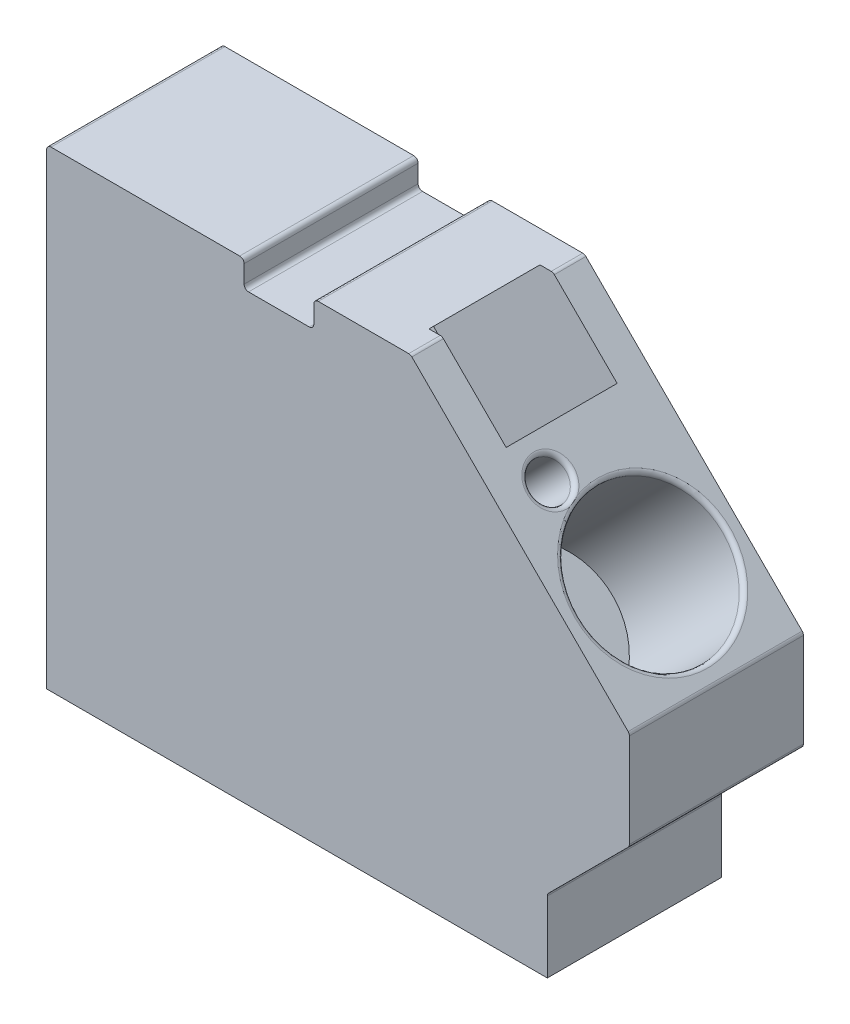
from build123d import *

# Parameters (mm, degrees)
EXTRUDE1_DEPTH = 9.9568
SKETCH2_R      = 4.191000000000001
SKETCH2_R_2    = 1.079499999999997
EXTRUDE2_DEPTH = 9.144
FILLET1_R      = 0.254


with BuildPart() as part:
    # Sketch1 → Extrude1 (new body)
    with BuildSketch(Plane.XY):
        with BuildLine():
            Line((0, 0), (0, 26.720799999999993))
            ThreePointArc((0, 26.720799999999993), (0.07439487757861757, 26.900405122421375), (0.2540000000000018, 26.974799999999995))
            Line((0.2540000000000018, 26.974799999999995), (11.048999999999998, 26.9748))
            ThreePointArc((11.048999999999998, 26.9748), (11.228605122421383, 26.900405122421382), (11.303, 26.720799999999997))
            Line((11.303, 26.720799999999997), (11.303, 25.704799999999995))
            ThreePointArc((11.303, 25.704799999999995), (11.377394877578618, 25.52519487757861), (11.557000000000002, 25.450799999999994))
            Line((11.557000000000002, 25.450799999999994), (15.036799999999998, 25.450799999999994))
            ThreePointArc((15.036799999999998, 25.450799999999994), (15.216405122421383, 25.52519487757861), (15.2908, 25.704799999999995))
            Line((15.2908, 25.704799999999995), (15.2908, 26.720799999999997))
            ThreePointArc((15.2908, 26.720799999999997), (15.365194877578617, 26.900405122421382), (15.5448, 26.9748))
            Line((15.5448, 26.9748), (20.72278975515723, 26.974800000000002))
            ThreePointArc((20.72278975515723, 26.974800000000002), (20.819991346977968, 26.955465401257868), (20.902394877578615, 26.90040512242138))
            Line((20.902394877578615, 26.90040512242138), (33.275805122421374, 14.52699487757856))
            ThreePointArc((33.275805122421374, 14.52699487757856), (33.33086540125785, 14.444591346977912), (33.350199999999994, 14.347389755157183))
            Line((33.350199999999994, 14.347389755157183), (33.35019999999999, 8.969810244842721))
            ThreePointArc((33.35019999999999, 8.969810244842721), (33.33086540125785, 8.872608653021988), (33.275805122421374, 8.790205122421336))
            Line((33.275805122421374, 8.790205122421336), (28.72762045926646, 4.242020459266578))
            ThreePointArc((28.72762045926646, 4.242020459266578), (28.67256018042997, 4.159616928665926), (28.653225581687842, 4.0624153368451905))
            Line((28.653225581687842, 4.0624153368451905), (28.653225581687938, 4.34e-15))
            Line((28.653225581687938, 4.34e-15), (0, 0))
        make_face()
    extrude(amount=EXTRUDE1_DEPTH)

    # Sketch2 → Extrude2 (cut)
    with BuildSketch(Plane(origin=(23.90140000000005, 23.90139999999994, 0), x_dir=(0, 0, -1), z_dir=(0.7071067811865491, 0.707106781186546, 0))):
        with Locations(Location((-4.978399999999999, -8.204766282245217, 0), (0, 0, 90))):
            Circle(SKETCH2_R)
        with Locations(Location((-7.073900000000001, -2.887802416466178, 0), (0, 0, 90))):
            Circle(SKETCH2_R_2)
        Polygon((-8.153400000000001, 4.876233717754782), (-1.8034000000000028, 4.876233717754782), (-1.803400000000002, -0.838766282245218), (-8.153400000000001, -0.838766282245218), align=None)
    extrude(amount=-EXTRUDE2_DEPTH, mode=Mode.SUBTRACT)

    # Fillet1
    # the kernel refuses this fillet: 0.254 mm, written as the material it takes off along each edge
    with BuildSketch(Plane(origin=(29.70304587622637, 18.099754123773593, 4.978399999999999), x_dir=(-0.7071067811865458, 0.7071067811865491, 0), z_dir=(0, 0, -1))) as fillet1_piece_1:
        with BuildLine():
            CenterArc((4.191000000000001 + FILLET1_R, -FILLET1_R), FILLET1_R, 89.99999999999982, 89.9999999999984)
            Line((4.190999999999995, -FILLET1_R), (4.191000000000001, 1e-16))
            Line((4.191000000000001, 1e-16), (4.191000000000001 + FILLET1_R, -8.03e-15))
        make_face()
    revolve(axis=Axis((29.70304587622637, 18.099754123773593, 4.978399999999999), (0.7071067811865491, 0.707106781186546, 0)), mode=Mode.SUBTRACT)
    with BuildSketch(Plane(origin=(25.94338467141018, 21.8594153285898, 7.073900000000001), x_dir=(-0.7071067811865476, 0.7071067811865476, 0), z_dir=(0, 0, -1.0000000000000002))) as fillet1_piece_2:
        with BuildLine():
            CenterArc((1.079499999999997 + FILLET1_R, -FILLET1_R), FILLET1_R, 90, 89.99999999999832)
            Line((1.0794999999999895, -FILLET1_R), (1.079499999999997, -3e-17))
            Line((1.079499999999997, -3e-17), (1.079499999999997 + FILLET1_R, -5.05e-15))
        make_face()
    revolve(axis=Axis((25.94338467141018, 21.8594153285898, 7.073900000000001), (0.7071067811865491, 0.707106781186546, 0)), mode=Mode.SUBTRACT)


solid = part.part
